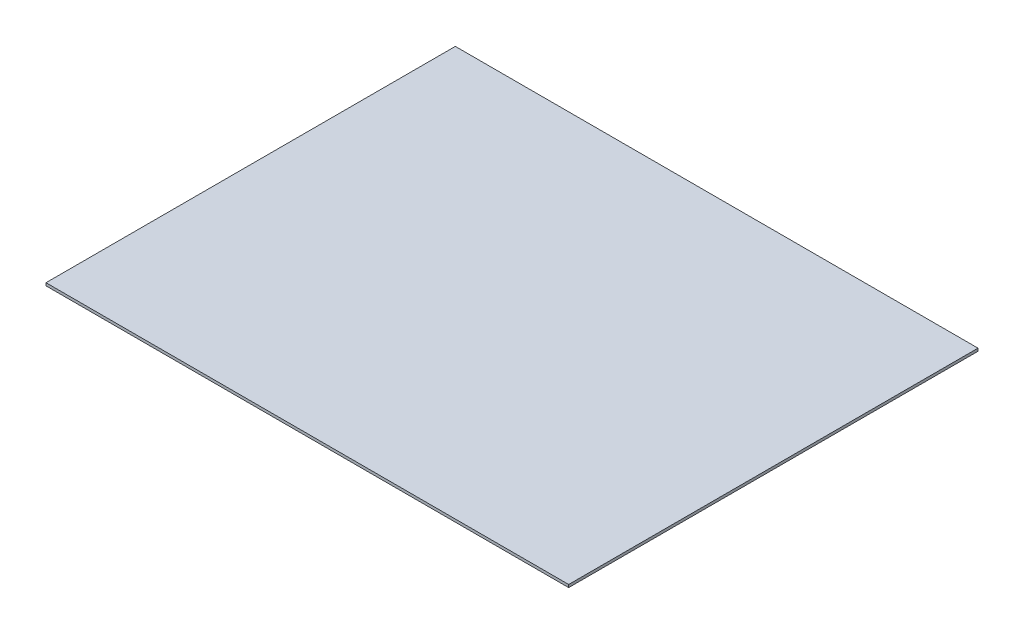
from build123d import *

# Parameters (mm, degrees)
SKETCH1_W           = 249
SKETCH1_H           = 195
BOSS_EXTRUDE1_DEPTH = 1.3


with BuildPart() as part:
    # Sketch1 → Boss-Extrude1 (new body)
    with BuildSketch(Plane(origin=(0, 0, 0), x_dir=(1, 0, 0), z_dir=(0, 1, 0))):
        Rectangle(SKETCH1_W, SKETCH1_H)
    extrude(amount=BOSS_EXTRUDE1_DEPTH)


solid = part.part
